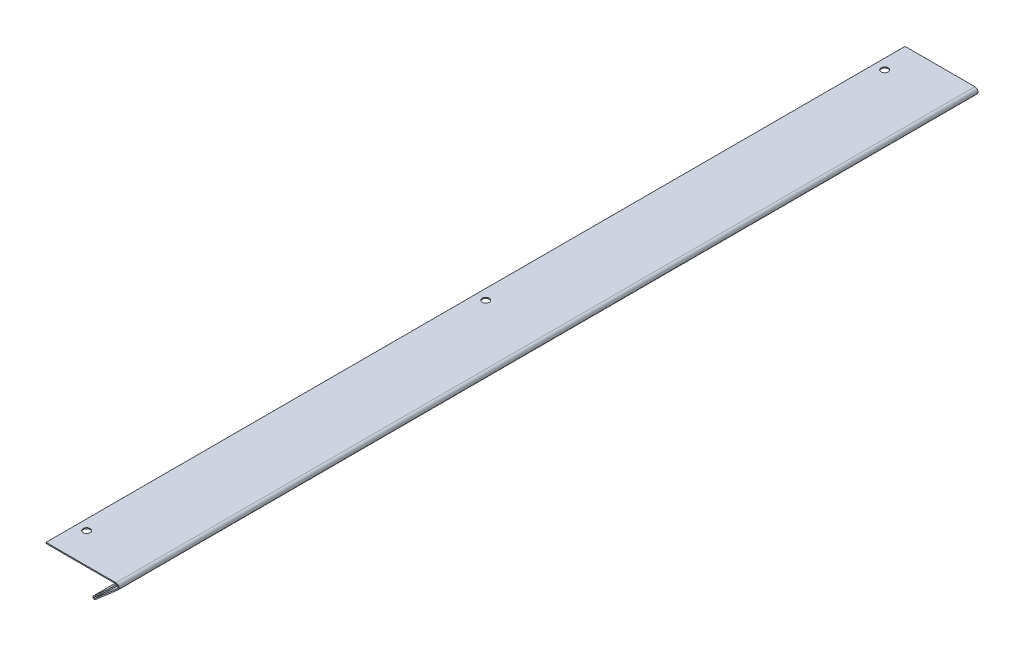
from build123d import *

# Parameters (mm, degrees)
SKETCH1_W                    = 37
SKETCH1_H                    = 0.5
BASE_FLANGE1_DEPTH           = 211
SKETCH6_R                    = 1.75
CUT_EXTRUDE1_DEPTH           = 10
EDGE_FLANGE1_STRIP_CUT_DEPTH = 422
EDGE_FLANGE1_DEPTH           = 422
HEM1_START                   = -211
HEM1_DEPTH                   = 422
HEM1_2_DEPTH                 = 422


with BuildPart() as part:
    # Base-Flange1: sheet metal written as solids
    # Sketch1 → Base-Flange1 (new, symmetric)
    with BuildSketch(Plane.XY):
        with Locations((18.5, -0.25)):
            Rectangle(SKETCH1_W, SKETCH1_H)
    extrude(amount=BASE_FLANGE1_DEPTH, both=True)

    # Sketch6 → Cut-Extrude1 (cut)
    with BuildSketch(Plane(origin=(0, 0, 0), x_dir=(1, 0, 0), z_dir=(0, 1, 0))):
        with Locations(Location((5, 196, 0), (0, 0, 270))):
            Circle(SKETCH6_R)
        with Locations(Location((5, 0, 0), (0, 0, 270))):
            Circle(SKETCH6_R)
        with Locations(Location((5, -196, 0), (0, 0, 270))):
            Circle(SKETCH6_R)
    extrude(amount=-CUT_EXTRUDE1_DEPTH, mode=Mode.SUBTRACT)

    # Edge-Flange1: sheet metal written as solids
    # Edge-Flange1 strip (on a plane across the edge) → Edge-Flange1 strip cut (cut)
    with BuildSketch(Plane(origin=(37, -0.5, -211), x_dir=(-0.6560590289905086, 0.754709580222771, 0), z_dir=(0, 0, 1))):
        Polygon((-4.886773951, -6.383716909), (2.13206437, 1.69053295), (1.75470958, 2.018562465), (-5.264128741, -6.055687395), align=None)
    extrude(amount=EDGE_FLANGE1_STRIP_CUT_DEPTH, mode=Mode.SUBTRACT)

    # Edge-Flange1 section (on a plane across the edge) → Edge-Flange1 (add)
    with BuildSketch(Plane(origin=(37, -0.5, -211), x_dir=(-0.6560590289905086, 0.754709580222771, 0), z_dir=(0, 0, 1))):
        with BuildLine():
            Line((-0.5, 2.674621494), (-0.5, 18))
            Line((-0.5, 18), (0, 18))
            Line((0, 18), (0, 2.674621494))
            ThreePointArc((0, 2.674621494), (0.649792619, 1.737949305), (1.75470958, 2.018562465))
            Line((1.75470958, 2.018562465), (2.13206437, 1.69053295))
            ThreePointArc((2.13206437, 1.69053295), (0.474688928, 1.26961321), (-0.5, 2.674621494))
        make_face()
    extrude(amount=EDGE_FLANGE1_DEPTH)

    # Hem1: read off the stored shape, not the designer's step
    # Hem1 outline → Hem1 (cut)
    with BuildSketch(Plane.XY.offset(HEM1_START)):
        with BuildLine():
            ThreePointArc((24.309289256, -12.19437304), (23.892198615, -12.374586092), (23.447599479, -12.280922038))
            Line((23.447599479, -12.280922038), (23.415227556, -12.309062522))
            Line((23.415227556, -12.309062522), (23.74325707, -12.686417312))
            Line((23.74325707, -12.686417312), (24.309289256, -12.19437304))
        make_face()
    extrude(amount=HEM1_DEPTH, mode=Mode.SUBTRACT)

    # Hem1 2 outline → Hem1 2 (add)
    with BuildSketch(Plane.XY.offset(HEM1_START)):
        with BuildLine():
            Line((30.634293844, -5.371117442), (30.306264329, -4.993762652))
            Line((30.306264329, -4.993762652), (23.325200712, -11.06230867))
            ThreePointArc((23.325200712, -11.06230867), (23.070999747, -11.703294486), (23.447599479, -12.280922038))
            Line((23.447599479, -12.280922038), (23.981259741, -11.81701825))
            ThreePointArc((23.981259741, -11.81701825), (23.628567589, -11.792355612), (23.653230227, -11.43966346))
            Line((23.653230227, -11.43966346), (30.634293844, -5.371117442))
        make_face()
    extrude(amount=HEM1_2_DEPTH)


solid = part.part
